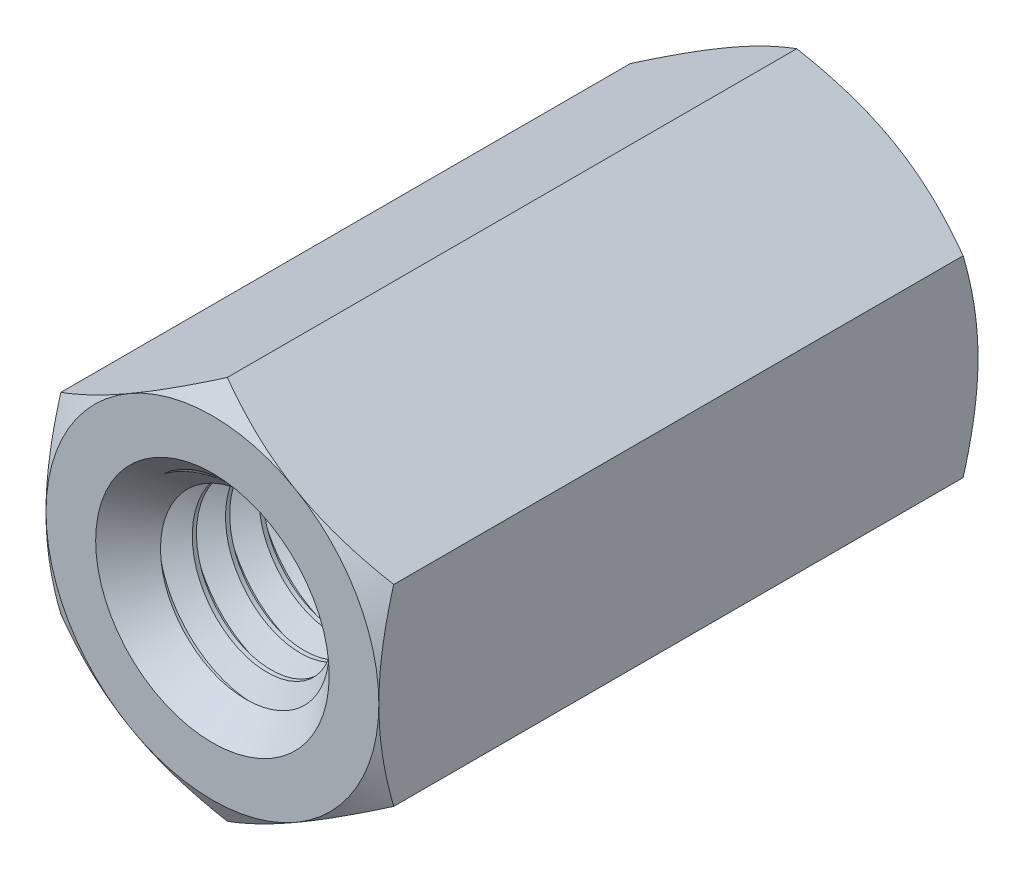
from build123d import *

# Parameters (mm, degrees)
EXTRUDE1_DEPTH     = 9
SKETCH2_OUTSIDE_W  = 46.692
SKETCH2_OUTSIDE_H  = 47.466
SKETCH2_OUTSIDE_R  = 2.5
CUT_EXTRUDE1_DEPTH = 10.776672917
CUT_EXTRUDE1_DRAFT = -60
SKETCH3_OUTSIDE_W  = 46.692
SKETCH3_OUTSIDE_H  = 47.466
SKETCH3_OUTSIDE_R  = 2.5
CUT_EXTRUDE2_DEPTH = 10.776672917
CUT_EXTRUDE2_DRAFT = -60
SKETCH4_R          = 1.5
CUT_EXTRUDE3_DEPTH = 10.776672917
SKETCH12_R         = 1.5
SKETCH12_R_2       = 1.175240474
EXTRUDE2_DEPTH     = 9
CUT_SWEEP1_PITCH   = 0.5


with BuildPart() as part:
    # Sketch1 → Extrude1 (new body)
    with BuildSketch(Plane.XY):
        Polygon((0, 2.886751346), (-2.5, 1.443375673), (-2.5, -1.443375673), (0, -2.886751346), (2.5, -1.443375673), (2.5, 1.443375673), align=None)
    extrude(amount=-EXTRUDE1_DEPTH)


with BuildPart() as cut_extrude1_tool:
    # Sketch2 outside → Cut-Extrude1 (with draft: the straight prism first)
    with BuildSketch(Plane.XY):
        Rectangle(SKETCH2_OUTSIDE_W, SKETCH2_OUTSIDE_H)
        Circle(SKETCH2_OUTSIDE_R, mode=Mode.SUBTRACT)
    extrude(amount=-CUT_EXTRUDE1_DEPTH)
    # Cut-Extrude1: the draft: its side faces are tilted about the plane it starts from
    cut_extrude1_sides = [cut_extrude1_tool.faces().sort_by_distance(p)[0] for p in [
        (0, -23.733, -5.388336459),
        (23.346, 0, -5.388336459),
        (0, 23.733, -5.388336459),
        (-23.346, 0, -5.388336459),
        (-2.5, 0, -5.388336459),
    ]]
    draft(cut_extrude1_sides, Plane.XY, CUT_EXTRUDE1_DRAFT)


with BuildPart() as part_1:
    add(part.part)

    # Cut-Extrude1: cut by cut_extrude1_tool
    add(cut_extrude1_tool.part, mode=Mode.SUBTRACT)


with BuildPart() as cut_extrude2_tool:
    # Sketch3 outside → Cut-Extrude2 (with draft: the straight prism first)
    with BuildSketch(Plane(origin=(0, 0, -9), x_dir=(-1, 0, 0), z_dir=(0, 0, -1))):
        Rectangle(SKETCH3_OUTSIDE_W, SKETCH3_OUTSIDE_H)
        Circle(SKETCH3_OUTSIDE_R, mode=Mode.SUBTRACT)
    extrude(amount=-CUT_EXTRUDE2_DEPTH)
    # Cut-Extrude2: the draft: its side faces are tilted about the plane it starts from
    cut_extrude2_sides = [cut_extrude2_tool.faces().sort_by_distance(p)[0] for p in [
        (0, -23.733, -3.611663541),
        (-23.346, 0, -3.611663541),
        (0, 23.733, -3.611663541),
        (23.346, 0, -3.611663541),
        (2.5, 0, -3.611663541),
    ]]
    draft(cut_extrude2_sides, Plane(origin=(0, 0, -9), x_dir=(-1, 0, 0), z_dir=(0, 0, -1)), CUT_EXTRUDE2_DRAFT)


with BuildPart() as part_2:
    add(part_1.part)

    # Cut-Extrude2: cut by cut_extrude2_tool
    add(cut_extrude2_tool.part, mode=Mode.SUBTRACT)

    # Sketch4 → Cut-Extrude3 (cut, through all)
    with BuildSketch(Plane.XY):
        Circle(SKETCH4_R)
    extrude(amount=-CUT_EXTRUDE3_DEPTH, mode=Mode.SUBTRACT)

    # Sketch12 → Extrude2 (add)
    with BuildSketch(Plane.XY):
        Circle(SKETCH12_R)
        Circle(SKETCH12_R_2, mode=Mode.SUBTRACT)
    extrude(amount=-EXTRUDE2_DEPTH)

    # Cut-Sweep1: the profile of Sketch9 profile screwed along a right-hand helix of 19 turns, 6 arcs to a turn; built about Z, then put on its axis
    cut_sweep1_z = Axis((0, 0, 0), (0, 0, 1))
    cut_sweep1_corners = [(1.5, 0, -0.25), (1.5, 0, -0.1875), (1.174940474, 0, 0.000173205), (1.174940474, 0, -0.437673205)]
    with BuildLine(mode=Mode.PRIVATE) as cut_sweep1_profile:
        Line(cut_sweep1_corners[0], cut_sweep1_corners[1])
        Line(cut_sweep1_corners[1], cut_sweep1_corners[2])
        Line(cut_sweep1_corners[2], cut_sweep1_corners[3])
        Line(cut_sweep1_corners[3], cut_sweep1_corners[0])
    cut_sweep1_cap = Face(cut_sweep1_profile.wire())
    cut_sweep1_turn_angles = [0, 30, 60, 90, 120, 150, 180, 210, 240, 270, 300, 330, 360]
    cut_sweep1_turn_weights = [1, 0.8660254037844387, 1, 0.8660254037844387, 1, 0.8660254037844387, 1, 0.8660254037844387, 1, 0.8660254037844387, 1, 0.8660254037844387, 1]
    cut_sweep1_turn_rails = [Edge.make_bspline([Vector(p[0], p[1], 0).rotate(cut_sweep1_z, cut_sweep1_turn_angles[k]) / cut_sweep1_turn_weights[k] + Vector(0, 0, p[2] + CUT_SWEEP1_PITCH * cut_sweep1_turn_angles[k] / 360) for k in range(13)], [0, 0, 0, 1, 1, 2, 2, 3, 3, 4, 4, 5, 5, 6, 6, 6], 2, cut_sweep1_turn_weights) for p in cut_sweep1_corners]
    cut_sweep1_turn_sides = [Face.make_surface_from_curves(cut_sweep1_turn_rails[p[0]], cut_sweep1_turn_rails[p[1]]) for p in [(0, 1), (1, 2), (2, 3), (3, 0)]]
    cut_sweep1 = Plane(origin=(0, 0, 0), x_dir=(0, 1, 0), z_dir=(0, 0, -1)) * Solid(Shell([*[p.moved(Location((0, 0, CUT_SWEEP1_PITCH * i))) for i in range(19) for p in cut_sweep1_turn_sides], cut_sweep1_cap, cut_sweep1_cap.rotate(cut_sweep1_z, 6840).moved(Location((0, 0, CUT_SWEEP1_PITCH * 6840 / 360)))]))
    add(cut_sweep1, mode=Mode.SUBTRACT)

    # Cut-Extrude6 cone 1 section (through the dimple's axis) → Cut-Extrude6 (revolve, cut)
    with BuildSketch(Plane(origin=(0, 0, 0), x_dir=(0, -1, 0), z_dir=(1, 0, 0))):
        Polygon((0, 0), (1.754, 0), (0, 1.754), align=None)
    revolve(axis=Axis((0, 0, 0), (0, 0, -1)), mode=Mode.SUBTRACT)

    # Cut-Extrude7 cone 1 section (through the dimple's axis) → Cut-Extrude7 (revolve, cut)
    with BuildSketch(Plane(origin=(0, 0, -9), x_dir=(0, 1, 0), z_dir=(1, 0, 0))):
        Polygon((0, 0), (1.754, 0), (0, 1.754), align=None)
    revolve(axis=Axis((0, 0, -9), (0, 0, 1)), mode=Mode.SUBTRACT)


solid = part_2.part
